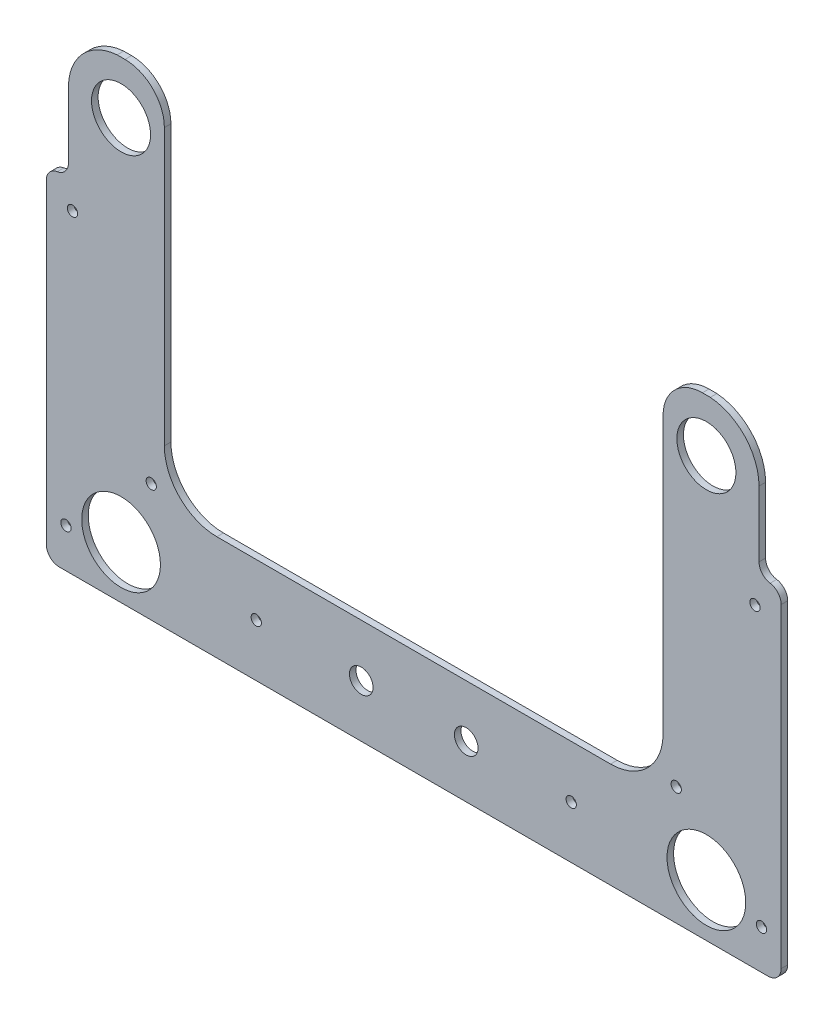
from build123d import *

# Parameters (mm, degrees)
SKETCH1_R           = 14.2875
SKETCH1_R_2         = 19.05
SKETCH1_R_3         = 2.4892
SKETCH1_R_4         = 5.715
BOSS_EXTRUDE3_DEPTH = 3.175
SKETCH2_W           = 355.6
SKETCH2_H           = 19.05
CUT_EXTRUDE1_DEPTH  = 290.621961572
FILLET1_R           = 19.05
CUT_EXTRUDE2_DEPTH  = 290.621961572
FILLET2_R           = 6.35


with BuildPart() as part:
    # Sketch1 → Boss-Extrude3 (new body)
    with BuildSketch(Plane.XY):
        with BuildLine():
            Line((120.65, -152.4), (120.65, -6.35))
            Line((120.65, -6.35), (120.65, 6.35))
            ThreePointArc((120.65, 6.35), (124.369743879, 15.330256121), (133.35, 19.05))
            Line((133.35, 19.05), (165.1, 19.05))
            ThreePointArc((165.1, 19.05), (174.080256121, 15.330256121), (177.8, 6.35))
            Line((177.8, 6.35), (177.8, -6.35))
            Line((177.8, -6.35), (177.8, -222.25))
            ThreePointArc((177.8, -222.25), (175.940128061, -226.740128061), (171.45, -228.6))
            Line((171.45, -228.6), (12.7, -228.6))
            Line((12.7, -228.6), (-12.7, -228.6))
            Line((-12.7, -228.6), (-171.45, -228.6))
            ThreePointArc((-171.45, -228.6), (-175.940128061, -226.740128061), (-177.8, -222.25))
            Line((-177.8, -222.25), (-177.8, -6.35))
            Line((-177.8, -6.35), (-177.8, 6.35))
            ThreePointArc((-177.8, 6.35), (-174.080256121, 15.330256121), (-165.1, 19.05))
            Line((-165.1, 19.05), (-133.35, 19.05))
            ThreePointArc((-133.35, 19.05), (-124.369743879, 15.330256121), (-120.65, 6.35))
            Line((-120.65, 6.35), (-120.65, -6.35))
            Line((-120.65, -6.35), (-120.65, -152.4))
            ThreePointArc((-120.65, -152.4), (-113.210512242, -170.360512242), (-95.25, -177.8))
            Line((-95.25, -177.8), (-12.7, -177.8))
            Line((-12.7, -177.8), (12.7, -177.8))
            Line((12.7, -177.8), (95.25, -177.8))
            ThreePointArc((95.25, -177.8), (113.210512242, -170.360512242), (120.65, -152.4))
        make_face()
        with Locations((141.605, -25.4)):
            Circle(SKETCH1_R, mode=Mode.SUBTRACT)
        with Locations((-141.605, -25.4)):
            Circle(SKETCH1_R, mode=Mode.SUBTRACT)
        with Locations((-141.605, -203.2)):
            Circle(SKETCH1_R_2, mode=Mode.SUBTRACT)
        with Locations((141.605, -203.2)):
            Circle(SKETCH1_R_2, mode=Mode.SUBTRACT)
        with Locations((-76.2, -203.2)):
            Circle(SKETCH1_R_3, mode=Mode.SUBTRACT)
        with Locations((76.2, -203.2)):
            Circle(SKETCH1_R_3, mode=Mode.SUBTRACT)
        with Locations((-25.4, -203.2)):
            Circle(SKETCH1_R_4, mode=Mode.SUBTRACT)
        with Locations((-149.225, 6.35)):
            Circle(SKETCH1_R_3, mode=Mode.SUBTRACT)
        with Locations((149.225, 6.35)):
            Circle(SKETCH1_R_3, mode=Mode.SUBTRACT)
        with Locations((-168.275, -209.55)):
            Circle(SKETCH1_R_3, mode=Mode.SUBTRACT)
        with Locations((168.275, -209.55)):
            Circle(SKETCH1_R_3, mode=Mode.SUBTRACT)
        with Locations((-165.1, -76.2)):
            Circle(SKETCH1_R_3, mode=Mode.SUBTRACT)
        with Locations((165.1, -76.2)):
            Circle(SKETCH1_R_3, mode=Mode.SUBTRACT)
        with Locations((-127, -171.45)):
            Circle(SKETCH1_R_3, mode=Mode.SUBTRACT)
        with Locations((127, -171.45)):
            Circle(SKETCH1_R_3, mode=Mode.SUBTRACT)
        with Locations((25.4, -203.2)):
            Circle(SKETCH1_R_4, mode=Mode.SUBTRACT)
    extrude(amount=BOSS_EXTRUDE3_DEPTH)

    # Sketch2 → Cut-Extrude1 (cut, through all)
    with BuildSketch(Plane.XY.offset(3.175)):
        with Locations((0, 9.525)):
            Rectangle(SKETCH2_W, SKETCH2_H)
    extrude(amount=-CUT_EXTRUDE1_DEPTH, mode=Mode.SUBTRACT)

    # Fillet1
    fillet1_edges = [part.edges().sort_by_distance(p)[0] for p in [
        (177.8, 0, 1.5875),
        (120.65, 0, 1.5875),
        (-120.65, 0, 1.5875),
        (-177.8, 0, 1.5875),
    ]]
    fillet(fillet1_edges, radius=FILLET1_R)

    # Sketch3 → Cut-Extrude2 (cut, through all)
    with BuildSketch(Plane.XY.offset(3.175)):
        with BuildLine():
            Line((-167.076337323, -57.15), (-167.076337323, -25.4))
            ThreePointArc((-167.076337323, -25.4), (-160.277331437, -8.075651132), (-143.51, 0))
            Line((-143.51, 0), (-177.8, 0))
            Line((-177.8, 0), (-177.8, -63.5))
            Line((-177.8, -63.5), (-173.426337323, -63.5))
            ThreePointArc((-173.426337323, -63.5), (-168.936209262, -61.640128061), (-167.076337323, -57.15))
        make_face()
    cut_extrude2 = extrude(amount=-CUT_EXTRUDE2_DEPTH, mode=Mode.SUBTRACT)

    # Mirror1: Cut-Extrude2 across plane
    add(cut_extrude2.mirror(Plane.ZY), mode=Mode.SUBTRACT)

    # Fillet2
    fillet2_edges = [part.edges().sort_by_distance(p)[0] for p in [
        (177.8, -63.5, 1.5875),
        (-177.8, -63.5, 1.5875),
    ]]
    fillet(fillet2_edges, radius=FILLET2_R)


solid = part.part
